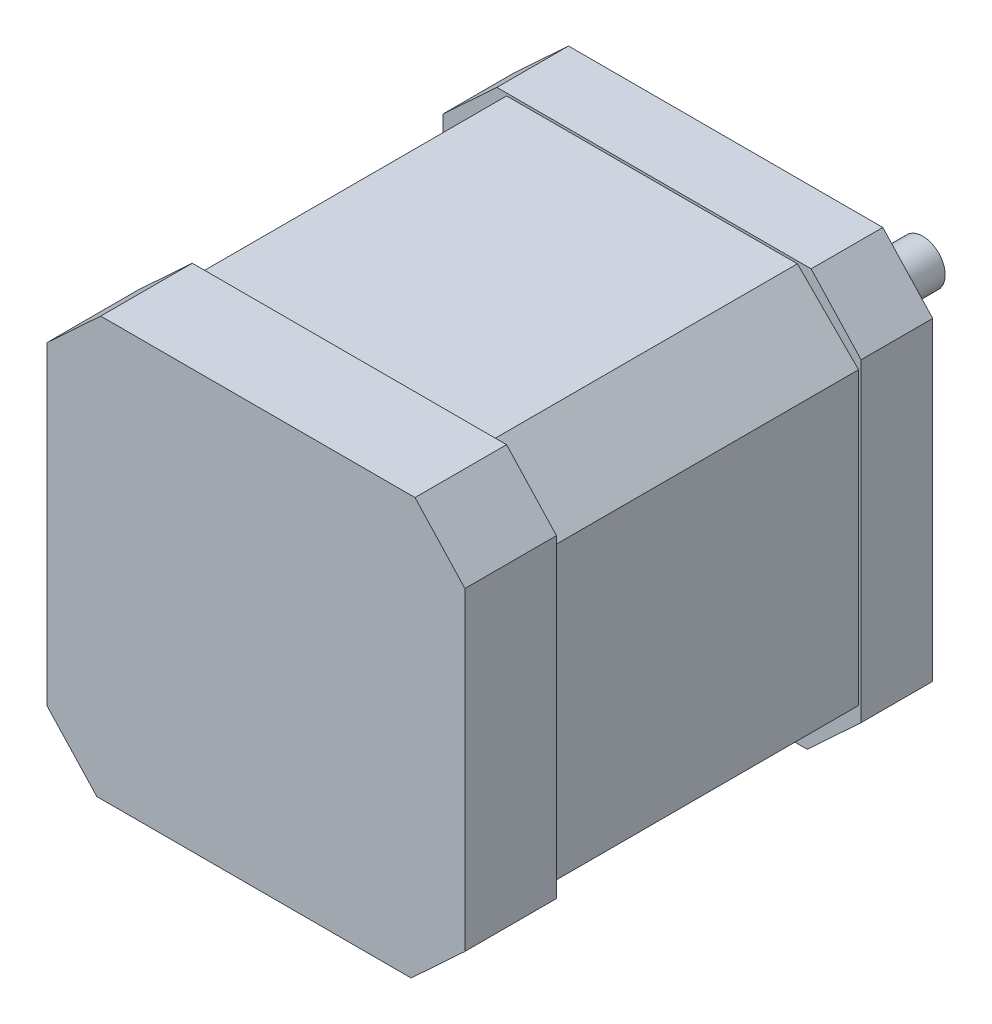
from build123d import *

# Parameters (mm, degrees)
RESSALTO_EXTRUS_O1_DEPTH   = 47
CORTE_EXTRUS_O_FINA1_START = -39.8
CORTE_EXTRUS_O_FINA1_DEPTH = 30.6
ESBO_O3_R                  = 2.25
RESSALTO_EXTRUS_O2_DEPTH   = 20
ESBO_O4_R                  = 10
RESSALTO_EXTRUS_O3_DEPTH   = 2
ESBO_O5_R                  = 1.5
CORTE_EXTRUS_O1_DEPTH      = 10


# Read off the part's stored shape, not the designer's step: Corte-Extrusão-Fina1
with BuildPart() as part:
    # Esboço1 → Ressalto-extrusão1 (new body)
    with BuildSketch(Plane.XY):
        Polygon((-21, -15.592171873), (-15.984175996, -21), (15.592171873, -21), (21, -15.984175996), (21, 15.592171873), (15.984175996, 21), (-15.592171873, 21), (-21, 15.984175996), align=None)
    extrude(amount=RESSALTO_EXTRUS_O1_DEPTH)

    # Corte-Extrusão-Fina1 outline → Corte-Extrusão-Fina1 (cut)
    with BuildSketch(Plane.XY.offset(47).offset(CORTE_EXTRUS_O_FINA1_START)):
        Polygon((15.592171873, -21), (21, -15.984175996), (21, 15.592171873), (15.984175996, 21), (-15.592171873, 21), (-21, 15.984175996), (-21, -15.592171873), (-15.984175996, -21), align=None)
        Polygon((14.605339059, 20.75), (20.75, 14.605339059), (20.75, -14.605339059), (14.605339059, -20.75), (-14.605339059, -20.75), (-20.75, -14.605339059), (-20.75, 14.605339059), (-14.605339059, 20.75), align=None, mode=Mode.SUBTRACT)
    extrude(amount=CORTE_EXTRUS_O_FINA1_DEPTH, mode=Mode.SUBTRACT)

    # Esboço3 → Ressalto-extrusão2 (add)
    with BuildSketch(Plane(origin=(0, 0, 0), x_dir=(-1, 0, 0), z_dir=(0, 0, -1))):
        with Locations(Location((0, 0, 0), (0, 0, 180))):
            Circle(ESBO_O3_R)
    extrude(amount=RESSALTO_EXTRUS_O2_DEPTH)

    # Esboço4 → Ressalto-extrusão3 (add)
    with BuildSketch(Plane(origin=(0, 0, 0), x_dir=(-1, 0, 0), z_dir=(0, 0, -1))):
        with Locations(Location((0, 0, 0), (0, 0, 180))):
            Circle(ESBO_O4_R)
    extrude(amount=RESSALTO_EXTRUS_O3_DEPTH)

    # Esboço5 → Corte-extrusão1 (cut)
    with BuildSketch(Plane(origin=(0, 0, 0), x_dir=(-1, 0, 0), z_dir=(0, 0, -1))):
        with Locations((15.5, -15.5)):
            Circle(ESBO_O5_R)
        with Locations((-15.5, -15.5)):
            Circle(ESBO_O5_R)
        with Locations((-15.5, 15.5)):
            Circle(ESBO_O5_R)
        with Locations((15.5, 15.5)):
            Circle(ESBO_O5_R)
    extrude(amount=-CORTE_EXTRUS_O1_DEPTH, mode=Mode.SUBTRACT)


solid = part.part
